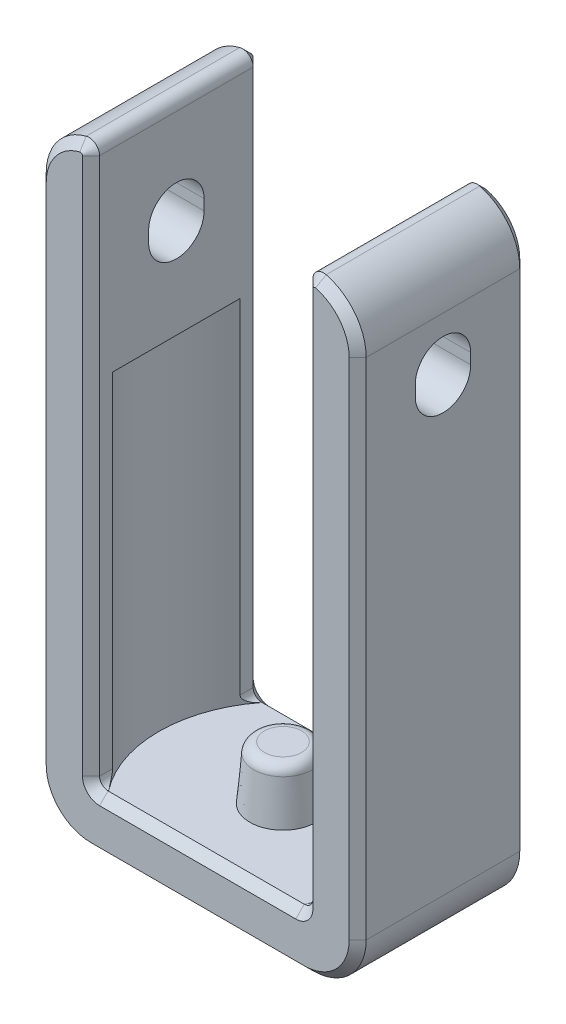
from build123d import *

# Parameters (mm, degrees)
BOSS_EXTRUDE1_DEPTH = 16
FILLET3_R           = 0.8
CUT_EXTRUDE1_START  = 5
SKETCH3_R           = 11.65
CUT_EXTRUDE1_DEPTH  = 33
SKETCH2_R           = 3.1
BOSS_EXTRUDE2_DEPTH = 5
BOSS_EXTRUDE2_TAPER = 5
CUT_EXTRUDE2_DEPTH  = 67.627997142
FILLET1_R           = 5
FILLET2_R           = 1
CHAMFER2_SIZE       = 0.8


with BuildPart() as part:
    # Sketch1 → Boss-Extrude1 (new body)
    with BuildSketch(Plane.XY):
        Polygon((0, 0), (0, 57.3), (5, 57.3), (5, 5), (25, 5), (25, 57.3), (30, 57.3), (30, 0), align=None)
    extrude(amount=BOSS_EXTRUDE1_DEPTH)

    # Fillet3
    fillet3_edges = [part.edges().sort_by_distance(p)[0] for p in [
        (5, 5, 8),
        (25, 5, 8),
    ]]
    fillet(fillet3_edges, radius=FILLET3_R)

    # Sketch3 → Cut-Extrude1 (cut)
    with BuildSketch(Plane(origin=(0, 0, 0), x_dir=(1, 0, 0), z_dir=(0, 1, 0)).offset(CUT_EXTRUDE1_START)):
        with Locations((15, -8)):
            Circle(SKETCH3_R)
    extrude(amount=CUT_EXTRUDE1_DEPTH, mode=Mode.SUBTRACT)

    # Sketch2 → Boss-Extrude2 (add)
    with BuildSketch(Plane(origin=(0, 5, 0), x_dir=(1, 0, 0), z_dir=(0, 1, 0))):
        with Locations((15, -8)):
            Circle(SKETCH2_R)
    extrude(amount=BOSS_EXTRUDE2_DEPTH, taper=BOSS_EXTRUDE2_TAPER)

    # Sketch5 → Cut-Extrude2 (cut, through all)
    with BuildSketch(Plane(origin=(30, 0, 0), x_dir=(0, 0, -1), z_dir=(1, 0, 0))):
        with BuildLine():
            Line((-5.4, 47.8), (-5.4, 46.8))
            ThreePointArc((-5.4, 46.8), (-8, 44.2), (-10.6, 46.8))
            Line((-10.6, 46.8), (-10.6, 47.8))
            ThreePointArc((-10.6, 47.8), (-8, 50.4), (-5.4, 47.8))
        make_face()
    extrude(amount=-CUT_EXTRUDE2_DEPTH, mode=Mode.SUBTRACT)

    # Fillet1
    fillet1_edges = [part.edges().sort_by_distance(p)[0] for p in [
        (0, 0, 8),
        (30, 0, 8),
        (30, 57.3, 8),
        (0, 57.3, 8),
    ]]
    fillet(fillet1_edges, radius=FILLET1_R - 0.0001)  # a hair under: the kernel refuses the full size

    # Fillet2
    fillet2_edges = [part.edges().sort_by_distance(p)[0] for p in [
        (5, 57.3, 8),
        (25, 57.3, 8),
        (12.337443318, 10, 8),
    ]]
    fillet(fillet2_edges, radius=FILLET2_R)

    # Chamfer2
    chamfer2_edges = [part.edges().sort_by_distance(p)[0] for p in [
        (1.047161628, 55.361939214, 0),
        (30, 28.65, 16),
        (15, 0, 16),
        (0, 28.65, 16),
        (28.535563195, 1.464436805, 16),
        (1.464436805, 1.464436805, 16),
        (28.952838372, 55.361939214, 16),
        (25, 30.986502943, 16),
        (25, 30.986502943, 0),
        (28.952838372, 55.361939214, 0),
        (4.61238009, 56.963569371, 0),
        (25.38761991, 56.963569371, 0),
        (1.047161628, 55.361939214, 16),
        (4.61238009, 56.963569371, 16),
        (25.38761991, 56.963569371, 16),
        (5, 30.986502943, 0),
        (5, 30.986502943, 16),
        (15, 5, 0),
        (15, 5, 16),
        (5.234314575, 5.234314575, 0),
        (5.234314575, 5.234314575, 16),
        (24.765685425, 5.234314575, 0),
        (24.765685425, 5.234314575, 16),
        (15, 0, 0),
        (0, 28.65, 0),
        (30, 28.65, 0),
        (28.535563195, 1.464436805, 0),
        (1.464436805, 1.464436805, 0),
    ]]
    chamfer(chamfer2_edges, length=CHAMFER2_SIZE)


solid = part.part
